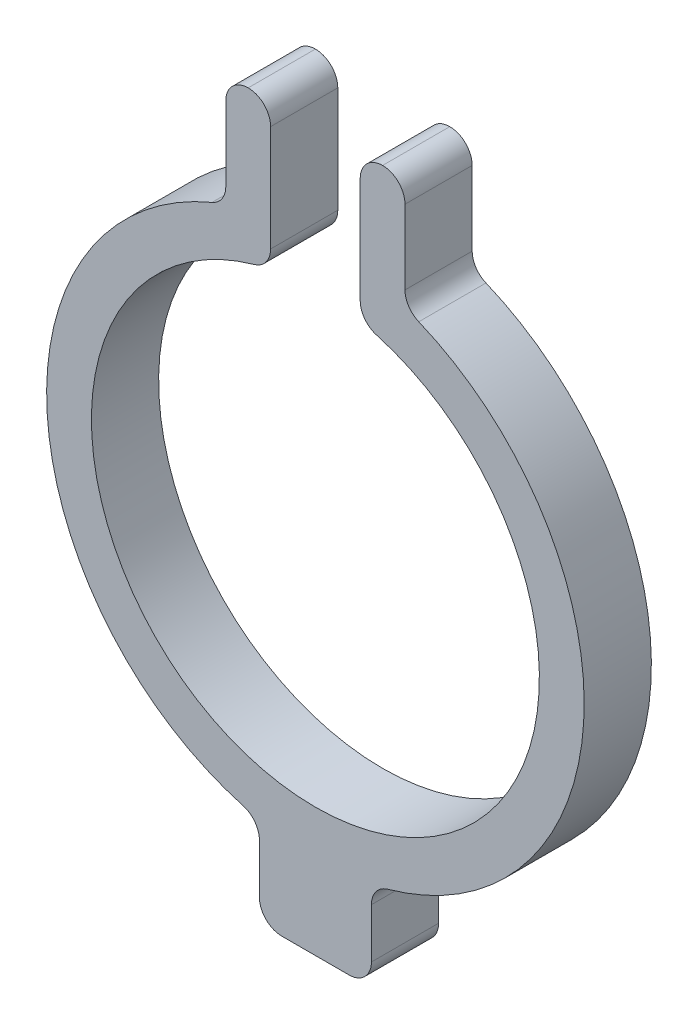
from build123d import *

# Parameters (mm, degrees)
BOSS_EXTRUDE1_DEPTH = 6
FILLET1_R           = 2


with BuildPart() as part:
    # Sketch1 → Boss-Extrude1 (new body)
    with BuildSketch(Plane.XY):
        with BuildLine():
            Line((4, 32.627416998), (8, 32.627416998))
            Line((8, 32.627416998), (8, 22.627416998))
            ThreePointArc((8, 22.627416998), (23.949344099, -1.558498392), (5, -23.473389189))
            Line((5, -23.473389189), (5, -31.473389189))
            Line((5, -31.473389189), (-5, -31.473389189))
            Line((-5, -31.473389189), (-5, -23.473389189))
            ThreePointArc((-5, -23.473389189), (-23.949344099, -1.558498392), (-8, 22.627416998))
            Line((-8, 22.627416998), (-8, 32.627416998))
            Line((-8, 32.627416998), (-4, 32.627416998))
            Line((-4, 32.627416998), (-4, 19.595917942))
            ThreePointArc((-4, 19.595917942), (0, -20), (4, 19.595917942))
            Line((4, 19.595917942), (4, 32.627416998))
        make_face()
    extrude(amount=BOSS_EXTRUDE1_DEPTH)

    # Fillet1
    fillet1_edges = [part.edges().sort_by_distance(p)[0] for p in [
        (-4, 19.595917942, 3),
        (4, 19.595917942, 3),
        (-8, 22.627416998, 3),
        (8, 32.627416998, 3),
        (4, 32.627416998, 3),
        (-4, 32.627416998, 3),
        (-8, 32.627416998, 3),
        (-5, -31.473389189, 3),
        (-5, -23.473389189, 3),
        (5, -31.473389189, 3),
        (5, -23.473389189, 3),
        (8, 22.627416998, 3),
    ]]
    fillet(fillet1_edges, radius=FILLET1_R - 0.0001)  # a hair under: the kernel refuses the full size


solid = part.part
